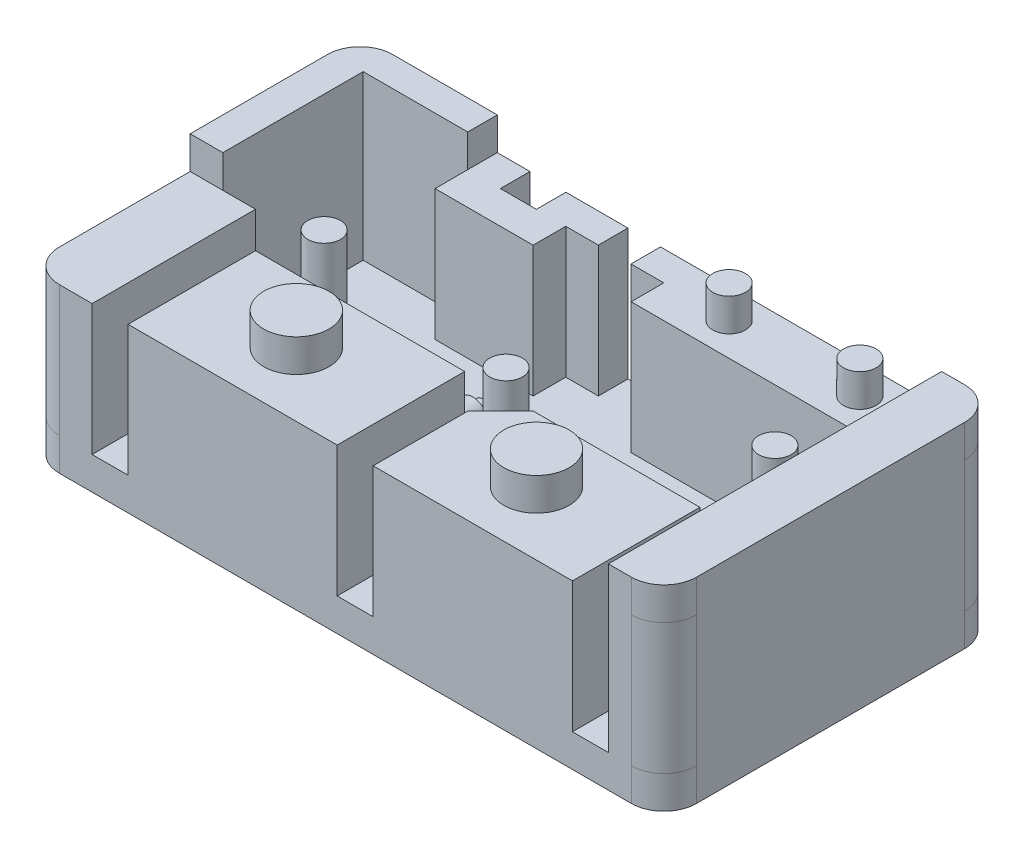
from build123d import *

# Parameters (mm, degrees)
SZKIC1_W                     = 19.5
SZKIC1_H                     = 10.2
DODANIE_WYCI_GNI_CIE2_DEPTH  = 1
ZAOKR_GLENIE1_R              = 1
ZAOKR_GLENIE2_R              = 1
ZAOKR_GLENIE3_R              = 1
ZAOKR_GLENIE4_R              = 1
SZKIC4_R                     = 0.5
SZKIC4_W                     = 6.4
SZKIC4_H                     = 3.9
DODANIE_WYCI_GNI_CIE4_DEPTH  = 4
ZAOKR_GLENIE5_R              = 1
ZAOKR_GLENIE6_R              = 1
ZAOKR_GLENIE7_R              = 1
ZAOKR_GLENIE8_R              = 1
SZKIC8_R                     = 1
SZKIC8_R_2                   = 0.5
SZKIC8_W                     = 1.7
SZKIC8_H                     = 10.2
DODANIE_WYCI_GNI_CIE12_DEPTH = 1
ZAOKR_GLENIE12_R             = 1
SZKIC12_R                    = 0.25
DODANIE_WYCI_GNI_CIE14_DEPTH = 1.3
SZKIC15_R                    = 0.450396943
SZKIC15_R_2                  = 0.398132247
DODANIE_WYCI_GNI_CIE15_DEPTH = 1


with BuildPart() as part:
    # Szkic1 → Dodanie-wyciągnięcie2 (new body)
    with BuildSketch(Plane(origin=(0, 0, 0), x_dir=(1, 0, 0), z_dir=(0, 1, 0))):
        Rectangle(SZKIC1_W, SZKIC1_H)
    extrude(amount=DODANIE_WYCI_GNI_CIE2_DEPTH)

    # Zaokrąglenie1
    zaokr_glenie1_edges = [part.edges().sort_by_distance(p)[0] for p in [
        (-9.75, 0.5, 5.1),
    ]]
    fillet(zaokr_glenie1_edges, radius=ZAOKR_GLENIE1_R)

    # Zaokrąglenie2
    zaokr_glenie2_edges = [part.edges().sort_by_distance(p)[0] for p in [
        (-9.75, 0.5, -5.1),
    ]]
    fillet(zaokr_glenie2_edges, radius=ZAOKR_GLENIE2_R)

    # Zaokrąglenie3
    zaokr_glenie3_edges = [part.edges().sort_by_distance(p)[0] for p in [
        (9.75, 0.5, 5.1),
    ]]
    fillet(zaokr_glenie3_edges, radius=ZAOKR_GLENIE3_R)

    # Zaokrąglenie4
    zaokr_glenie4_edges = [part.edges().sort_by_distance(p)[0] for p in [
        (9.75, 0.5, -5.1),
    ]]
    fillet(zaokr_glenie4_edges, radius=ZAOKR_GLENIE4_R)

    # Szkic4 → Dodanie-wyciągnięcie4 (add)
    with BuildSketch(Plane(origin=(0, 1, 0), x_dir=(1, 0, 0), z_dir=(0, 1, 0))):
        with Locations(Location((0.279656429, -0.460729366, 0), (0, 0, 270))):
            Circle(SZKIC4_R)
        with Locations(Location((-6.15, 0.4, 0), (0, 0, 270))):
            Circle(SZKIC4_R)
        with Locations(Location((6.45, 1.595263288, 0), (0, 0, 270))):
            Circle(SZKIC4_R)
        Polygon((-8.75, -0.1), (-7.75, -0.1), (-7.75, -5.1), (-9.75, -5.1), (-9.75, 5.1), (-4.55, 5.1), (-4.55, 4.195263288), (-3.45, 4.195263288), (-3.45, 5.1), (-1.552474018, 5.1), (-1.552474018, 4.195263288), (-2.55, 4.195263288), (-2.55, 3.195263288), (-5.55, 3.195263288), (-5.55, 4.195263288), (-8.75, 4.195263288), align=None)
        with Locations((-3.45, -3.15)):
            Rectangle(SZKIC4_W, SZKIC4_H)
        Polygon((0.85, -5.1), (6.95, -5.1), (6.95, -1.2), (1.85, -1.2), (0.85, -2.2), align=None)
        Polygon((8.05, -5.1), (9.75, -5.1), (9.75, 5.1), (-0.553774682, 5.1), (-0.553774682, 4.195263288), (0.45, 4.195263288), (0.45, 3.195263288), (8.05, 3.195263288), align=None)
    extrude(amount=DODANIE_WYCI_GNI_CIE4_DEPTH)

    # Zaokrąglenie5
    zaokr_glenie5_edges = [part.edges().sort_by_distance(p)[0] for p in [
        (-9.75, 3, 5.1),
    ]]
    fillet(zaokr_glenie5_edges, radius=ZAOKR_GLENIE5_R)

    # Zaokrąglenie6
    zaokr_glenie6_edges = [part.edges().sort_by_distance(p)[0] for p in [
        (-9.75, 3, -5.1),
    ]]
    fillet(zaokr_glenie6_edges, radius=ZAOKR_GLENIE6_R)

    # Zaokrąglenie7
    zaokr_glenie7_edges = [part.edges().sort_by_distance(p)[0] for p in [
        (9.75, 3, -5.1),
    ]]
    fillet(zaokr_glenie7_edges, radius=ZAOKR_GLENIE7_R)

    # Zaokrąglenie8
    zaokr_glenie8_edges = [part.edges().sort_by_distance(p)[0] for p in [
        (9.75, 3, 5.1),
    ]]
    fillet(zaokr_glenie8_edges, radius=ZAOKR_GLENIE8_R)

    # Szkic8 → Dodanie-wyciągnięcie12 (add)
    with BuildSketch(Plane(origin=(0, 5, 0), x_dir=(1, 0, 0), z_dir=(0, 1, 0))):
        with Locations(Location((-3.45, -3.15, 0), (0, 0, 90))):
            Circle(SZKIC8_R)
        with Locations(Location((3.9, -3.15, 0), (0, 0, 90))):
            Circle(SZKIC8_R)
        with Locations(Location((6.45, 4.195263288, 0), (0, 0, 90))):
            Circle(SZKIC8_R_2)
        with Locations(Location((2.45, 4.195263288, 0), (0, 0, 90))):
            Circle(SZKIC8_R_2)
        Polygon((-8.75, -0.1), (-9.75, -0.1), (-9.75, 5.1), (-5.55, 5.1), (-5.55, 4.195263288), (-8.75, 4.195263288), align=None)
        with Locations((8.9, 0)):
            Rectangle(SZKIC8_W, SZKIC8_H)
    extrude(amount=DODANIE_WYCI_GNI_CIE12_DEPTH)

    # Zaokrąglenie12
    zaokr_glenie12_edges = [part.edges().sort_by_distance(p)[0] for p in [
        (9.75, 5.5, -5.1),
        (9.75, 5.5, 5.1),
        (-9.75, 5.5, -5.1),
    ]]
    fillet(zaokr_glenie12_edges, radius=ZAOKR_GLENIE12_R - 0.0001)  # a hair under: the kernel refuses the full size

    # Szkic12 → Dodanie-wyciągnięcie14 (add)
    with BuildSketch(Plane(origin=(0, 0, 1.2), x_dir=(-1, 0, 0), z_dir=(0, 0, -1))):
        with Locations(Location((1, 3, 0), (0, 0, 180))):
            Circle(SZKIC12_R)
    extrude(amount=DODANIE_WYCI_GNI_CIE14_DEPTH)

    # Szkic15 → Dodanie-wyciągnięcie15 (add)
    with BuildSketch(Plane(origin=(0, 0, 1.2), x_dir=(-1, 0, 0), z_dir=(0, 0, -1))):
        with Locations(Location((1, 3, 0), (0, 0, 180))):
            Circle(SZKIC15_R)
        with Locations((1, 3)):
            Circle(SZKIC15_R_2, mode=Mode.SUBTRACT)
    extrude(amount=DODANIE_WYCI_GNI_CIE15_DEPTH)


solid = part.part
